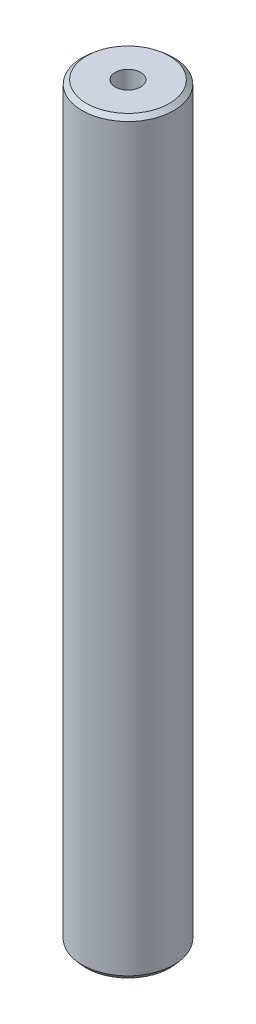
from build123d import *
from OCP.BRepFilletAPI import BRepFilletAPI_MakeChamfer

# Parameters (mm, degrees)
SKETCH1_R           = 7.5
BOSS_EXTRUDE1_DEPTH = 122.414115146
SKETCH2_R           = 2.086190852
CUT_EXTRUDE1_DEPTH  = 123.872761778
CHAMFER1_SIZE       = 0.628250362
CHAMFER1_SIZE2      = 0.748238375


with BuildPart() as part:
    # Sketch1 → Boss-Extrude1 (new body)
    with BuildSketch(Plane(origin=(0, 0, 0), x_dir=(1, 0, 0), z_dir=(0, 1, 0))):
        Circle(SKETCH1_R)
    extrude(amount=BOSS_EXTRUDE1_DEPTH)

    # Sketch2 → Cut-Extrude1 (cut, through all)
    with BuildSketch(Plane(origin=(0, 0, 0), x_dir=(1, 0, 0), z_dir=(0, 1, 0))):
        Circle(SKETCH2_R)
    extrude(amount=CUT_EXTRUDE1_DEPTH, mode=Mode.SUBTRACT)

    # Chamfer1: one chamfer whose edges measure the first distance from different faces: ONE call of the kernel's chamfer builder (chamfer() names one face for all edges)
    chamfer1_edges_1 = [part.edges().sort_by_distance(p)[0] for p in [
        (-7.5, 122.414115146, 0),
    ]]
    chamfer1_side_1 = [part.faces().sort_by_distance(p)[0] for p in [
        (-7.5, 61.207057573, 0),
    ]]
    chamfer1_edges_2 = [part.edges().sort_by_distance(p)[0] for p in [
        (-7.5, 0, 0),
    ]]
    chamfer1_side_2 = [part.faces().sort_by_distance(p)[0] for p in [
        (-7.287867966, 0, 0),
    ]]
    chamfer1 = BRepFilletAPI_MakeChamfer(part.part.solid().wrapped)
    for e in chamfer1_edges_1:
        chamfer1.Add(CHAMFER1_SIZE, CHAMFER1_SIZE2, e.wrapped, chamfer1_side_1[0].wrapped)  # the first distance lies on this face
    for e in chamfer1_edges_2:
        chamfer1.Add(CHAMFER1_SIZE, CHAMFER1_SIZE2, e.wrapped, chamfer1_side_2[0].wrapped)  # the first distance lies on this face
    add(Compound.cast(chamfer1.Shape()), mode=Mode.REPLACE)


solid = part.part
